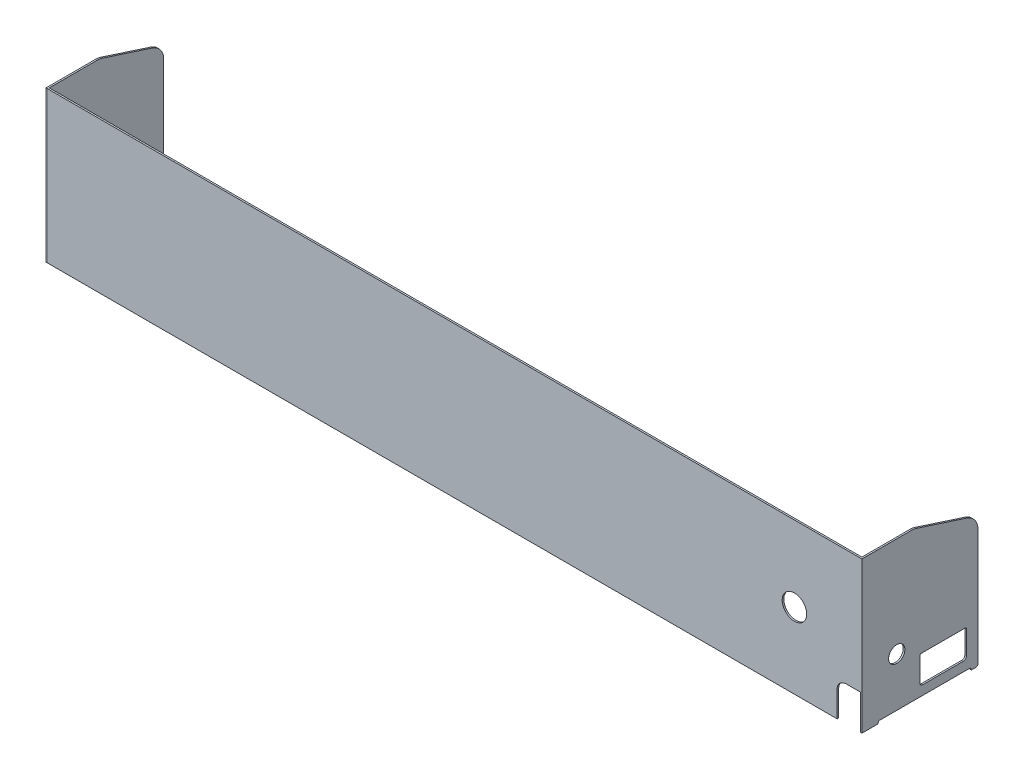
from build123d import *

# Parameters (mm, degrees)
BACK_WALL_DEPTH    = 0.7
SKETCH2_R          = 3.5
RIGHT_WALL_DEPTH   = 0.7
SKETCH4_R          = 5.277476853
CUT_EXTRUDE2_DEPTH = 10


with BuildPart() as part:
    # Sketch1 → Back Wall (new body)
    with BuildSketch(Plane.XY):
        with BuildLine():
            Line((175, -17.5), (169, -17.5))
            ThreePointArc((169, -17.5), (166.171572875, -18.671572875), (165, -21.5))
            Line((165, -21.5), (165, -32.5))
            Line((165, -32.5), (-175, -32.5))
            Line((-175, -32.5), (-175, 32.5))
            Line((-175, 32.5), (175, 32.5))
            Line((175, 32.5), (175, -17.5))
        make_face()
    extrude(amount=BACK_WALL_DEPTH)


with BuildPart() as body_2:
    # Sketch2 → Right Wall (new body)
    with BuildSketch(Plane.ZY.offset(175)):
        with BuildLine():
            Line((-48.3, -32.5), (-46.5, -32.5))
            ThreePointArc((-46.5, -32.5), (-46.358578644, -32.441421356), (-46.3, -32.3))
            Line((-46.3, -32.3), (-46.3, -32.2))
            ThreePointArc((-46.3, -32.2), (-46.094974747, -31.705025253), (-45.6, -31.5))
            Line((-45.6, -31.5), (-7, -31.5))
            ThreePointArc((-7, -31.5), (-6.505025253, -31.705025253), (-6.3, -32.2))
            Line((-6.3, -32.2), (-6.3, -32.3))
            ThreePointArc((-6.3, -32.3), (-6.241421356, -32.441421356), (-6.1, -32.5))
            Line((-6.1, -32.5), (0.7, -32.5))
            Line((0.7, -32.5), (0.7, 32.5))
            Line((0.7, 32.5), (-20.643340495, 32.5))
            ThreePointArc((-20.643340495, 32.5), (-21.733083601, 32.414655448), (-22.79625424, 32.160702846))
            Line((-22.79625424, 32.160702846), (-44.452913745, 25.160702846))
            ThreePointArc((-44.452913745, 25.160702846), (-47.959964497, 22.618835016), (-49.3, 18.5))
            Line((-49.3, 18.5), (-49.3, -31.5))
            ThreePointArc((-49.3, -31.5), (-49.007106781, -32.207106781), (-48.3, -32.5))
        make_face()
        with Locations((-14.3, -10.5)):
            Circle(SKETCH2_R, mode=Mode.SUBTRACT)
        with BuildLine():
            Line((-43.8, -15.5), (-24.8, -15.5))
            ThreePointArc((-24.8, -15.5), (-24.446446609, -15.646446609), (-24.3, -16))
            Line((-24.3, -16), (-24.3, -26.3))
            ThreePointArc((-24.3, -26.3), (-24.651471863, -27.148528137), (-25.5, -27.5))
            Line((-25.5, -27.5), (-43.1, -27.5))
            ThreePointArc((-43.1, -27.5), (-43.948528137, -27.148528137), (-44.3, -26.3))
            Line((-44.3, -26.3), (-44.3, -16))
            ThreePointArc((-44.3, -16), (-44.153553391, -15.646446609), (-43.8, -15.5))
        make_face(mode=Mode.SUBTRACT)
    right_wall = extrude(amount=RIGHT_WALL_DEPTH)


with BuildPart() as part_1:
    add(part.part)

    # Mirror8: Right Wall across plane
    add(right_wall.mirror(Plane(origin=(0, 0, 0), x_dir=(0, 0, 1), z_dir=(1, 0, 0))))

    # Sketch4 → Cut-Extrude2 (cut)
    with BuildSketch(Plane.XY.offset(0.7)):
        with Locations((146.639771961, 0)):
            Circle(SKETCH4_R)
    extrude(amount=-CUT_EXTRUDE2_DEPTH, mode=Mode.SUBTRACT)


solid = Compound([body_2.part, part_1.part])
